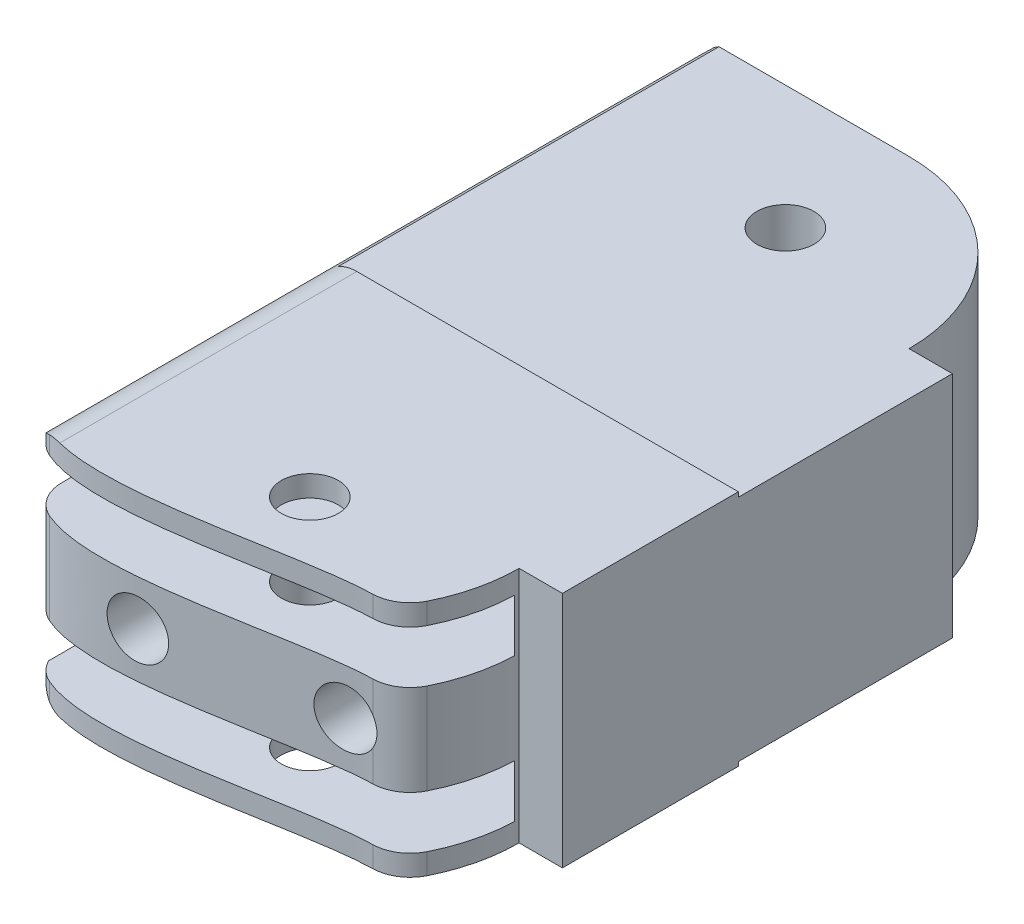
from build123d import *

# Parameters (mm, degrees)
SKETCH1_W               = 22.054431489
SKETCH1_H               = 12.5
BOSS_EXTRUDE1_DEPTH     = 38
CUT_EXTRUDE1_DEPTH      = 10
CUT_EXTRUDE1_DEPTH_BACK = 15
SKETCH2_R               = 1.5
FILLET3_R               = 2
SKETCH5_R               = 1.5
CUT_EXTRUDE4_DEPTH      = 53.86644408
SKETCH16_W              = 22.05443149
SKETCH16_H              = 2.749314183
SKETCH16_W_2            = 22.143232671
SKETCH16_H_2            = 2.765172048
CUT_EXTRUDE6_DEPTH      = 8.5
FILLET4_R               = 2
SKETCH17_W              = 18.547612126
SKETCH17_H              = 2.749314183
SKETCH17_H_2            = 2.765172048
CUT_EXTRUDE7_DEPTH      = 5
SKETCH18_W              = 23.880033653
SKETCH18_H              = 0.742090051
SKETCH18_W_2            = 23.982039935
SKETCH18_H_2            = 0.706785536
CUT_EXTRUDE8_DEPTH      = 20


with BuildPart() as part:
    # Sketch1 → Boss-Extrude1 (new body)
    with BuildSketch(Plane.XY):
        with Locations((-13.228930986, -24.070183414)):
            Rectangle(SKETCH1_W, SKETCH1_H)
    extrude(amount=BOSS_EXTRUDE1_DEPTH)

    # Sketch2 → Cut-Extrude1 (cut, two sides: drawn at the far end of the back side and taken through both)
    with BuildSketch(Plane.XZ.offset(30.320183414).offset(-CUT_EXTRUDE1_DEPTH_BACK)):
        with Locations(Location((-13.228930986, 6.5, 0), (0, 0, 90))):
            Circle(SKETCH2_R)
        with Locations(Location((-13.228930986, 31.5, 0), (0, 0, 90))):
            Circle(SKETCH2_R)
        with BuildLine():
            Line((-4.478930986, 29.25), (-2.201715242, 29.25))
            add(Edge.make_bspline(
                [(-24.256146731, 29.25), (-34.277912729, 38.417119108), (-13.227499763, 50.308047167), (7.840407292, 38.416977249), (-2.201715242, 29.25)],
                knots=[0, 0, 0, 0, 0.49986218, 1, 1, 1, 1], degree=3))
            add(Edge.make_bspline(
                [(-6.103895584, 34.329012749), (-10.720559386, 33.527203043), (-28.641384523, 40.845191705), (-24.256146731, 29.25)],
                knots=[0, 0, 0, 0, 1, 1, 1, 1], degree=3))
            ThreePointArc((-6.103895584, 34.329012749), (-4.895067543, 31.916312081), (-4.478930986, 29.25))
        make_face()
        with BuildLine():
            Line((-4.478930986, 8.75), (-2.201715242, 8.75))
            add(Edge.make_bspline(
                [(-2.201715242, 8.75), (5.39210746, 3.880294823), (-0.777052631, -4.523329032), (-17.174300591, -10.623347238), (-34.821400648, -0.026005424), (-24.256146731, 8.75)],
                knots=[0, 0, 0, 0, 0.283272691, 0.504244858, 1, 1, 1, 1], degree=3))
            add(Edge.make_bspline(
                [(-23.490579314, 0), (-24.966512963, 4.237786421), (-24.256146731, 8.75)],
                knots=[0, 0, 0, 1, 1, 1], degree=2))
            Line((-23.490579314, 0), (-13.228930986, 0))
            ThreePointArc((-13.228930986, 0), (-7.041746651, 2.562815665), (-4.478930986, 8.75))
        make_face()
    extrude(amount=CUT_EXTRUDE1_DEPTH + CUT_EXTRUDE1_DEPTH_BACK, mode=Mode.SUBTRACT)

    # Fillet3
    # the kernel refuses this fillet: 2 mm, written as the material it takes off along each edge
    with BuildSketch(Plane(origin=(-24.256146731, -17.820183414, -5.498495188), x_dir=(1, 0, 0), z_dir=(0, 0, 1))) as fillet3_piece_1:
        with BuildLine():
            CenterArc((FILLET3_R, -FILLET3_R), FILLET3_R, 90, 90)
            Line((0, -FILLET3_R), (-FILLET3_R * 0.02, -FILLET3_R))
            Line((-FILLET3_R * 0.02, -FILLET3_R), (-FILLET3_R * 0.02, FILLET3_R * 0.02))
            Line((-FILLET3_R * 0.02, FILLET3_R * 0.02), (FILLET3_R, FILLET3_R * 0.02))
            Line((FILLET3_R, FILLET3_R * 0.02), (FILLET3_R, 0))
        make_face()
    extrude(amount=44.984872581, mode=Mode.SUBTRACT)
    with BuildSketch(Plane(origin=(-24.256146731, -30.320183414, -5.498495188), x_dir=(1, 0, 0), z_dir=(0, 0, 1))) as fillet3_piece_2:
        with BuildLine():
            CenterArc((FILLET3_R, FILLET3_R), FILLET3_R, 180, 90)
            Line((0, FILLET3_R), (-FILLET3_R * 0.02, FILLET3_R))
            Line((-FILLET3_R * 0.02, FILLET3_R), (-FILLET3_R * 0.02, -FILLET3_R * 0.02))
            Line((-FILLET3_R * 0.02, -FILLET3_R * 0.02), (FILLET3_R, -FILLET3_R * 0.02))
            Line((FILLET3_R, -FILLET3_R * 0.02), (FILLET3_R, 0))
        make_face()
    extrude(amount=44.984872581, mode=Mode.SUBTRACT)
    with BuildSketch(Plane(origin=(-24.256146731, -17.374523396, 3.001504812), x_dir=(0.16676818592575765, -1.261066300243152e-15, -0.9859961319209278), z_dir=(0, -1, 0))) as fillet3_piece_3:
        with BuildLine():
            CenterArc((0.168096911, 1.999974157), FILLET3_R, 260.400032587, 9.891234523)
            Line((-0.165439461, 0.027981894), (-0.172110188, -0.011457952))
            Line((-0.172110188, -0.011457952), (-0.006670727, -0.039439845))
            Line((-0.006670727, -0.039439845), (-0.00020343, -0.039999483))
            ThreePointArc((-0.00020343, -0.039999483), (0.089132026, -0.040226606), (0.178467349, -0.039999483))
            Line((0.178467349, -0.039999483), (0.178264007, 0))
        make_face()
    extrude(amount=13.391320036, mode=Mode.SUBTRACT)
    with BuildSketch(Plane(origin=(-24.256146731, -14.125185169, 34.486377393), x_dir=(0.8125654725305003, 0, 0.5828699279009725), z_dir=(0, -1, 0))) as fillet3_piece_4:
        with BuildLine():
            CenterArc((1.058597408, -1.955531144), FILLET3_R, 77.895172565, 66.452175148)
            Line((-0.566533537, -0.789791288), (-0.599036156, -0.766476491))
            Line((-0.599036156, -0.766476491), (-0.032502619, 0.023314797))
            Line((-0.032502619, 0.023314797), (-0.009827922, 0.038773856))
            ThreePointArc((-0.009827922, 0.038773856), (0.740246051, 0.125750941), (1.486387336, 0.039110623))
            Line((1.486387336, 0.039110623), (1.477999298, 0))
        make_face()
    extrude(amount=19.88999649, mode=Mode.SUBTRACT)

    # Sketch5 → Cut-Extrude4 (cut, through all)
    with BuildSketch(Plane.XY):
        with Locations(Location((-18.011106811, -24.070183414, 0), (0, 0, 180))):
            Circle(SKETCH5_R)
        with Locations(Location((-8.446755162, -24.070183414, 0), (0, 0, 180))):
            Circle(SKETCH5_R)
    extrude(amount=CUT_EXTRUDE4_DEPTH, mode=Mode.SUBTRACT)

    # Sketch16 → Cut-Extrude6 (cut)
    with BuildSketch(Plane.XY.offset(38)):
        with Locations((-13.228930985, -20.306320009)):
            Rectangle(SKETCH16_W, SKETCH16_H)
        with Locations((-13.184530395, -27.841975748)):
            Rectangle(SKETCH16_W_2, SKETCH16_H_2)
    extrude(amount=-CUT_EXTRUDE6_DEPTH, mode=Mode.SUBTRACT)

    # Fillet4
    # the kernel refuses this fillet: 2 mm, written as the material it takes off along each edge
    with BuildSketch(Plane(origin=(-6.103895584, -22.334365667, 34.329012749), x_dir=(0.515368054600745, 0, -0.8569689424343473), z_dir=(0, 1, 0))) as fillet4_piece_1:
        with BuildLine():
            CenterArc((1.205528974, 1.993941708), FILLET4_R, 212.228268917, 62.232476225)
            Line((-0.486331325, 0.927354287), (-0.520168531, 0.906022538))
            ThreePointArc((-0.520168531, 0.906022538), (-0.25689069, 0.456334761), (-0.037300681, -0.01444504))
            Line((-0.037300681, -0.01444504), (-0.003111043, -0.039878834))
            ThreePointArc((-0.003111043, -0.039878834), (0.68054055, -0.066505026), (1.364192143, -0.039878834))
            Line((1.364192143, -0.039878834), (1.3610811, 0))
        make_face()
    extrude(amount=7.916885004, mode=Mode.SUBTRACT)
    with BuildSketch(Plane(origin=(-6.103895584, -29.862092474, 34.329012749), x_dir=(0.515368054600745, 0, -0.8569689424343473), z_dir=(0, 1, 0))) as fillet4_piece_2:
        with BuildLine():
            CenterArc((1.205528974, 1.993941708), FILLET4_R, 212.228268917, 62.232476225)
            Line((-0.486331325, 0.927354287), (-0.520168531, 0.906022538))
            ThreePointArc((-0.520168531, 0.906022538), (-0.25689069, 0.456334761), (-0.037300681, -0.01444504))
            Line((-0.037300681, -0.01444504), (-0.003111043, -0.039878834))
            ThreePointArc((-0.003111043, -0.039878834), (0.68054055, -0.066505026), (1.364192143, -0.039878834))
            Line((1.364192143, -0.039878834), (1.3610811, 0))
        make_face()
    extrude(amount=11.583818124, mode=Mode.SUBTRACT)
    with BuildSketch(Plane(origin=(-6.103895584, -33.722886164, 34.329012749), x_dir=(0.515368054600745, 0, -0.8569689424343473), z_dir=(0, 1, 0))) as fillet4_piece_3:
        with BuildLine():
            CenterArc((1.205528974, 1.993941708), FILLET4_R, 212.228268917, 62.232476225)
            Line((-0.486331325, 0.927354287), (-0.520168531, 0.906022538))
            ThreePointArc((-0.520168531, 0.906022538), (-0.25689069, 0.456334761), (-0.037300681, -0.01444504))
            Line((-0.037300681, -0.01444504), (-0.003111043, -0.039878834))
            ThreePointArc((-0.003111043, -0.039878834), (0.68054055, -0.066505026), (1.364192143, -0.039878834))
            Line((1.364192143, -0.039878834), (1.3610811, 0))
        make_face()
    extrude(amount=7.901027143, mode=Mode.SUBTRACT)

    # Sketch17 → Cut-Extrude7 (cut)
    with BuildSketch(Plane.XY.offset(29.5)):
        with Locations((-13.756309207, -20.306320009)):
            Rectangle(SKETCH17_W, SKETCH17_H)
        with Locations((-13.756309207, -27.841975748)):
            Rectangle(SKETCH17_W, SKETCH17_H_2)
    extrude(amount=-CUT_EXTRUDE7_DEPTH, mode=Mode.SUBTRACT)

    # Sketch18 → Cut-Extrude8 (cut)
    with BuildSketch(Plane.XY):
        with Locations((-13.859477608, -30.474932984)):
            Rectangle(SKETCH18_W, SKETCH18_H)
        with Locations((-13.808474467, -17.715166293)):
            Rectangle(SKETCH18_W_2, SKETCH18_H_2)
    extrude(amount=CUT_EXTRUDE8_DEPTH, mode=Mode.SUBTRACT)


solid = part.part
